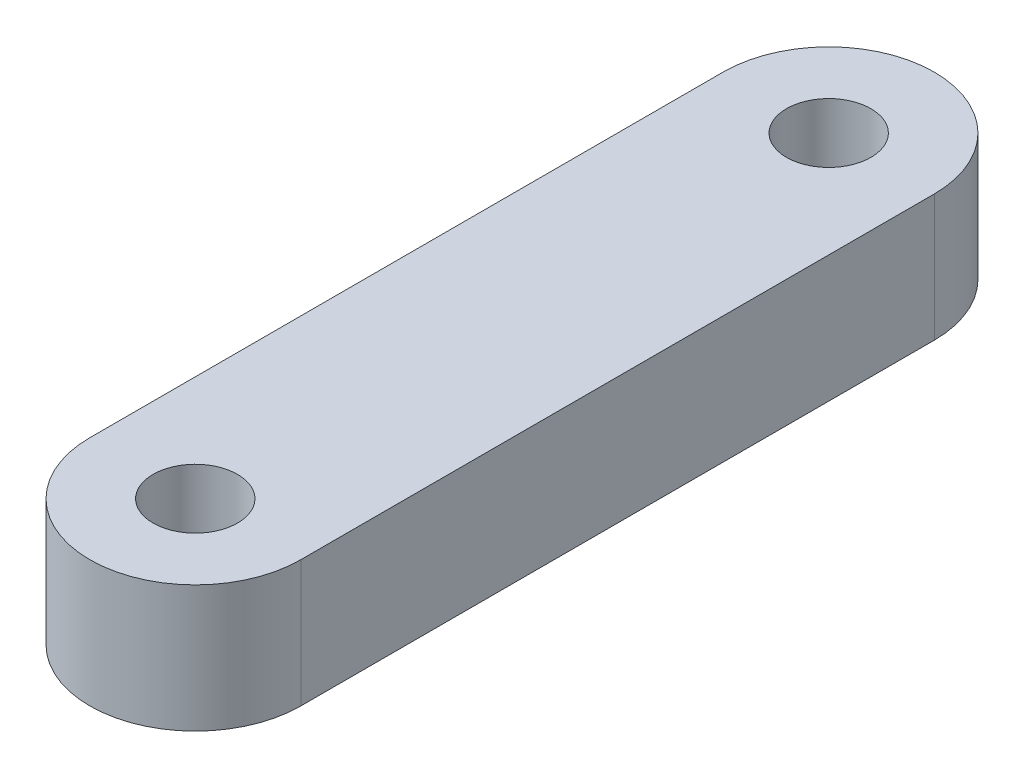
from build123d import *

# Parameters (mm, degrees)
CROQUIS1_R        = 1
BRIDA_BASE1_DEPTH = 3


# Sheet-metal steps are written as plain solids
with BuildPart() as part:
    # Croquis1 → Brida base1 (new body)
    with BuildSketch(Plane(origin=(0, 0, 0), x_dir=(1, 0, 0), z_dir=(0, 1, 0))):
        with BuildLine():
            Line((-2.5, -7.5), (-2.5, 7.5))
            ThreePointArc((-2.5, 7.5), (0, 10), (2.5, 7.5))
            Line((2.5, 7.5), (2.5, -7.5))
            ThreePointArc((2.5, -7.5), (0, -10), (-2.5, -7.5))
        make_face()
        with Locations(Location((0, 7.5, 0), (0, 0, 270))):
            Circle(CROQUIS1_R, mode=Mode.SUBTRACT)
        with Locations(Location((0, -7.5, 0), (0, 0, 270))):
            Circle(CROQUIS1_R, mode=Mode.SUBTRACT)
    extrude(amount=-BRIDA_BASE1_DEPTH)


solid = part.part
